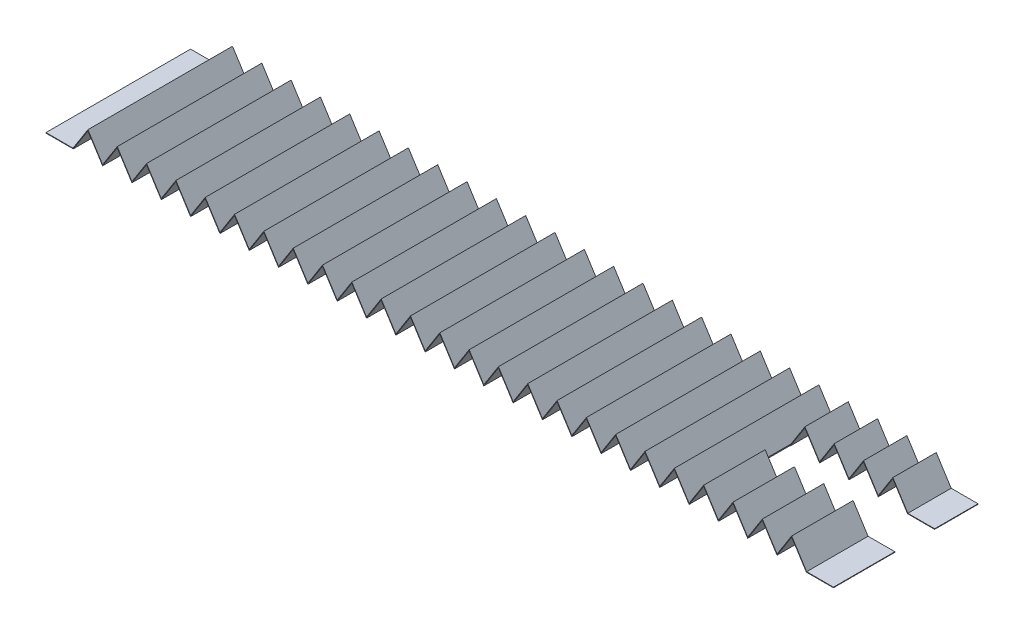
from build123d import *

# Parameters (mm, degrees)
EXTRUDE_THIN1_DEPTH     = 40
CUT_EXTRUDE4_DEPTH      = 423.821229931
CUT_EXTRUDE4_DEPTH_BACK = 423.821229931
SKETCH2_W               = 80
SKETCH2_H               = 22


with BuildPart() as part:
    # Sketch1 → Extrude-Thin1 (new, symmetric)
    with BuildSketch(Plane.XY):
        Polygon((-15.1, 0), (0, 0), (8.11429959, 12.734525596), (16.22859918, 0), (24.342898769, 12.734525596), (32.457198359, 0), (40.571497949, 12.734525596), (48.685797539, 0), (56.800097129, 12.734525596), (64.914396718, 0), (73.028696308, 12.734525596), (81.142995898, 0), (89.257295488, 12.734525596), (97.371595078, 0), (105.485894667, 12.734525596), (113.600194257, 0), (121.714493847, 12.734525596), (129.828793437, 0), (137.943093027, 12.734525596), (146.057392616, 0), (154.171692206, 12.734525596), (162.285991796, 0), (170.400291386, 12.734525596), (178.514590976, 0), (186.628890566, 12.734525596), (194.743190155, 0), (202.857489745, 12.734525596), (210.971789335, 0), (219.086088925, 12.734525596), (227.200388515, 0), (235.314688104, 12.734525596), (243.428987694, 0), (251.543287284, 12.734525596), (259.657586874, 0), (267.771886464, 12.734525596), (275.886186053, 0), (284.000485643, 12.734525596), (292.114785233, 0), (300.229084823, 12.734525596), (308.343384413, 0), (316.457684002, 12.734525596), (324.571983592, 0), (332.686283182, 12.734525596), (340.800582772, 0), (348.914882362, 12.734525596), (357.029181951, 0), (365.143481541, 12.734525596), (373.257781131, 0), (381.372080721, 12.734525596), (389.486380311, 0), (397.6006799, 12.734525596), (405.71497949, 0), (420.71497949, 0), (420.71497949, 0.3), (405.879548646, 0.3), (397.6006799, 13.29279929), (389.486380311, 0.558273693), (381.372080721, 13.29279929), (373.257781131, 0.558273693), (365.143481541, 13.29279929), (357.029181951, 0.558273693), (348.914882362, 13.29279929), (340.800582772, 0.558273693), (332.686283182, 13.29279929), (324.571983592, 0.558273693), (316.457684002, 13.29279929), (308.343384413, 0.558273693), (300.229084823, 13.29279929), (292.114785233, 0.558273693), (284.000485643, 13.29279929), (275.886186053, 0.558273693), (267.771886464, 13.29279929), (259.657586874, 0.558273693), (251.543287284, 13.29279929), (243.428987694, 0.558273693), (235.314688104, 13.29279929), (227.200388515, 0.558273693), (219.086088925, 13.29279929), (210.971789335, 0.558273693), (202.857489745, 13.29279929), (194.743190155, 0.558273693), (186.628890566, 13.29279929), (178.514590976, 0.558273693), (170.400291386, 13.29279929), (162.285991796, 0.558273693), (154.171692206, 13.29279929), (146.057392616, 0.558273693), (137.943093027, 13.29279929), (129.828793437, 0.558273693), (121.714493847, 13.29279929), (113.600194257, 0.558273693), (105.485894667, 13.29279929), (97.371595078, 0.558273693), (89.257295488, 13.29279929), (81.142995898, 0.558273693), (73.028696308, 13.29279929), (64.914396718, 0.558273693), (56.800097129, 13.29279929), (48.685797539, 0.558273693), (40.571497949, 13.29279929), (32.457198359, 0.558273693), (24.342898769, 13.29279929), (16.22859918, 0.558273693), (8.11429959, 13.29279929), (-0.164569155, 0.3), (-15.1, 0.3), align=None)
    extrude(amount=EXTRUDE_THIN1_DEPTH, both=True)

    # Sketch2 → Cut-Extrude4 (cut, two sides: drawn at the far end of the back side and taken through both)
    with BuildSketch(Plane(origin=(0, 0, 0), x_dir=(1, 0, 0), z_dir=(0, 1, 0)).offset(-CUT_EXTRUDE4_DEPTH_BACK)):
        with Locations((380.71497949, 5)):
            Rectangle(SKETCH2_W, SKETCH2_H)
    extrude(amount=CUT_EXTRUDE4_DEPTH + CUT_EXTRUDE4_DEPTH_BACK, mode=Mode.SUBTRACT)


solid = part.part
